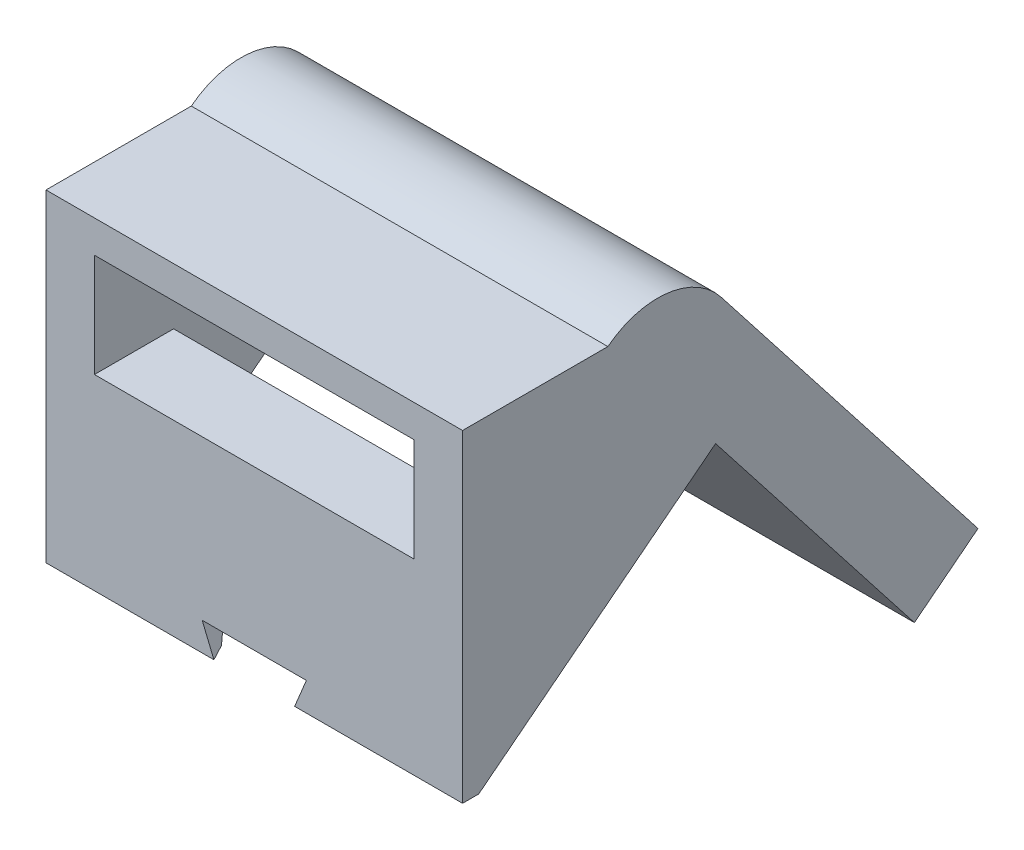
from build123d import *

# Parameters (mm, degrees)
EXTRUDE_1_DEPTH         = 35
CUT_EXTRUDE_1_DEPTH     = 8
CUT_EXTRUDE_2_DEPTH     = 9
EXTRUDE_2_DEPTH         = 6
CUT_EXTRUDE_3_DEPTH     = 3
SKETCH_9_R              = 2.6
CUT_EXTRUDE_4_DEPTH     = 3
CUT_EXTRUDE_5_DEPTH     = 90
SKETCH_11_R             = 5
SKETCH_11_R_2           = 2.6
EXTRUDE_3_DEPTH         = 2
FILLET_1_R              = 5
CUT_EXTRUDE_6_DEPTH     = 2
CUT_EXTRUDE_START       = -31.92392812
CUT_EXTRUDE_7_OUTLINE_W = 4.6
CUT_EXTRUDE_7_OUTLINE_H = 29
CUT_EXTRUDE_7_DEPTH     = 31.92392812
SKETCH_18_W             = 19.8
SKETCH_18_H             = 6.4
CUT_EXTRUDE_8_DEPTH     = 15
SKETCH_19_W             = 19.8
SKETCH_19_H             = 2
CUT_EXTRUDE_9_DEPTH     = 3


# Read off the part's stored shape, not the designer's step: 切除-拉伸7
with BuildPart() as part:
    # 草图1 → 凸台-拉伸1 (new body)
    with BuildSketch(Plane(origin=(0, 0, 0), x_dir=(0, 0, -1), z_dir=(1, 0, 0))):
        Polygon((0, 0), (9, 0), (15.670644845, -8.538036051), (1, -20), (0, -20), align=None)
    extrude(amount=-EXTRUDE_1_DEPTH)

    # 草图5 → 切除-拉伸1 (cut)
    with BuildSketch(Plane.XY):
        Polygon((-27.4, -8.4), (-7.6, -8.4), (-7.6, -2), (-17.5, -2), (-27.4, -2), align=None)
    extrude(amount=-CUT_EXTRUDE_1_DEPTH, mode=Mode.SUBTRACT)

    # 草图6 → 切除-拉伸2 (cut)
    with BuildSketch(Plane(origin=(0, -12.904366819, -10.081996315), x_dir=(1, 0, 0), z_dir=(0, -0.788010753606721, -0.6156614753256595))):
        Polygon((-7.6, 1.307903218), (-7.6, -5.092096782), (-17.5, -5.092096782), (-27.4, -5.092096782), (-27.4, 1.307903218), align=None)
    extrude(amount=-CUT_EXTRUDE_2_DEPTH, mode=Mode.SUBTRACT)

    # 草图7 → 凸台-拉伸2 (add)
    with BuildSketch(Plane(origin=(0, 4.366330768, -5.58864853), x_dir=(-1, 0, 0), z_dir=(0, 0.6156614753256597, -0.7880107536067209))):
        Polygon((0, -5.540953278), (35, -5.540953278), (35, -16.375876547), (35, -36.375876547), (0, -36.375876547), (0, -16.375876547), align=None)
    extrude(amount=EXTRUDE_2_DEPTH)

    # 草图8 → 切除-拉伸3 (cut)
    with BuildSketch(Plane(origin=(0, 8.06029962, -10.316713052), x_dir=(-1, 0, 0), z_dir=(0, 0.6156614753256597, -0.7880107536067209))):
        with BuildLine():
            ThreePointArc((13.158784289, -23.895181856), (15.019305308, -30.717092258), (21.841215711, -28.856571239))
            Line((21.841215711, -28.856571239), (13.158784289, -23.895181856))
        make_face()
        with BuildLine():
            Line((13.158784289, -23.895181856), (21.841215711, -28.856571239))
            ThreePointArc((21.841215711, -28.856571239), (22.332498244, -27.659216223), (22.5, -26.375876547))
            ThreePointArc((22.5, -26.375876547), (18.783339676, -21.543378304), (13.158784289, -23.895181856))
        make_face()
    extrude(amount=-CUT_EXTRUDE_3_DEPTH, mode=Mode.SUBTRACT)

    # 草图9 → 切除-拉伸4 (cut)
    with BuildSketch(Plane(origin=(0, 6.213315194, -7.952680791), x_dir=(-1, 0, 0), z_dir=(0, 0.6156614753256597, -0.7880107536067209))):
        with Locations(Location((17.5, -26.375876547, 0), (0, 0, 90))):
            Circle(SKETCH_9_R)
    extrude(amount=-CUT_EXTRUDE_4_DEPTH, mode=Mode.SUBTRACT)

    # 草图10 → 切除-拉伸5 (cut)
    with BuildSketch(Plane(origin=(0, 0, 0), x_dir=(0, 0, -1), z_dir=(1, 0, 0))):
        Polygon((12.940053768, 3.078307377), (31.92392812, -21.219943746), (32.711938873, -20.604282271), (13.728064522, 3.693968852), align=None)
    extrude(amount=-CUT_EXTRUDE_5_DEPTH, mode=Mode.SUBTRACT)

    # 草图11 → 凸台-拉伸3 (add)
    with BuildSketch(Plane(origin=(0, 7.444638145, -9.528702298), x_dir=(-1, 0, 0), z_dir=(0, 0.6156614753256598, -0.7880107536067208))):
        with Locations((17.5, -26.375876547)):
            Circle(SKETCH_11_R)
        with Locations(Location((17.5, -26.375876547, 0), (0, 0, 90))):
            Circle(SKETCH_11_R_2, mode=Mode.SUBTRACT)
    extrude(amount=-EXTRUDE_3_DEPTH)

    # 圆角1
    fillet_1_edges = [part.edges().sort_by_distance(p)[0] for p in [
        (-17.5, 3.078307377, -12.940053768),
    ]]
    fillet(fillet_1_edges, radius=FILLET_1_R - 0.0001)  # a hair under: the kernel refuses the full size

    # 草图16 → 切除-拉伸6 (cut)
    with BuildSketch(Plane(origin=(0, -12.904366819, -10.081996315), x_dir=(1, 0, 0), z_dir=(0, -0.788010753606721, -0.6156614753256595))):
        Polygon((-27.4, 1.307903218), (-20, 12.313229507), (-15, 12.313229507), (-7.6, 1.307903218), align=None)
    extrude(amount=-CUT_EXTRUDE_6_DEPTH, mode=Mode.SUBTRACT)

    # 切除-拉伸7 outline → 切除-拉伸7 (cut)
    with BuildSketch(Plane.XY.offset(CUT_EXTRUDE_START)):
        with Locations((-32.7, -11.5)):
            Rectangle(CUT_EXTRUDE_7_OUTLINE_W, CUT_EXTRUDE_7_OUTLINE_H)
        with Locations((-2.3, -11.5)):
            Rectangle(CUT_EXTRUDE_7_OUTLINE_W, CUT_EXTRUDE_7_OUTLINE_H)
    extrude(amount=CUT_EXTRUDE_7_DEPTH, mode=Mode.SUBTRACT)

    # 草图18 → 切除-拉伸8 (cut)
    with BuildSketch(Plane.XY):
        with Locations((-17.5, -5.2)):
            Rectangle(SKETCH_18_W, SKETCH_18_H)
    extrude(amount=-CUT_EXTRUDE_8_DEPTH, mode=Mode.SUBTRACT)

    # 草图19 → 切除-拉伸9 (cut)
    with BuildSketch(Plane(origin=(0, -12.904366819, -10.081996315), x_dir=(1, 0, 0), z_dir=(0, -0.788010753606721, -0.6156614753256595))):
        with Locations((-17.5, -6.092096782)):
            Rectangle(SKETCH_19_W, SKETCH_19_H)
    extrude(amount=-CUT_EXTRUDE_9_DEPTH, mode=Mode.SUBTRACT)


solid = part.part
